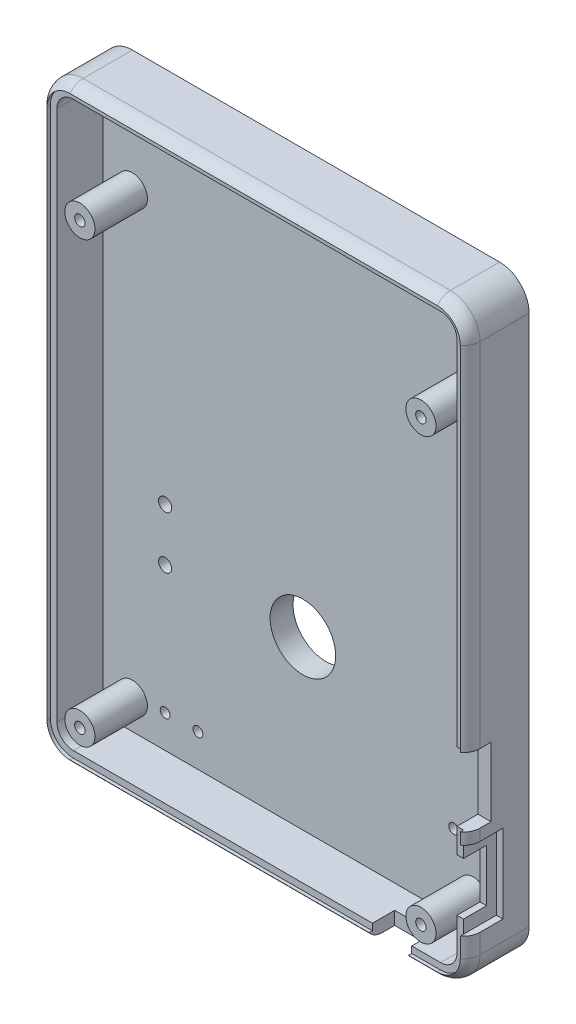
from build123d import *

# Parameters (mm, degrees)
TOP_PLATE_DEPTH                = 2
WALL_OUTER_HALF_DEPTH          = 10
WALL_INNER_HALF_DEPTH          = 9
LENS_FACE_ROUND_OVER_R         = 2.5
SKETCH_4_R                     = 8
SKETCH_4_R_2                   = 5
LENS_BEZEL_RING_DEPTH          = 1.5
SKETCH_5_R                     = 2.3
CORNER_POSTS_DEPTH             = 10
POST_START                     = 10
SKETCH_6_R                     = 0.8
POST_PILOT_HOLES_M2_DEPTH      = 7
SKETCH_7_W                     = 12
SKETCH_7_H                     = 1
GRIP_GROOVES_DEPTH             = 0.6
SKETCH_8_R                     = 1
BOOT_RESET_PINHOLES_DEPTH      = 108.993055471
SKETCH_9_W                     = 6
SKETCH_9_H                     = 4.2
SHUTTER_WINDOW_DEPTH           = 108.993055471
SKETCH_10_R                    = 5
LENS_HOLE_DEPTH                = 108.993055471
SKETCH_11_R                    = 0.75
LED_LIGHT_HOLES_D1_D4_D5_DEPTH = 108.993055471
USB_C_START                    = 59
SKETCH_12_W                    = 4.2
SKETCH_12_H                    = 10.5
USB_C_WINDOW_DEPTH             = 4.5
POWER_START                    = 59
SKETCH_13_W                    = 4.5
SKETCH_13_H                    = 8
POWER_SWITCH_SLOT_DEPTH        = 4.5
SWITCH_START                   = 61.5
SKETCH_14_W                    = 6
SKETCH_14_H                    = 12
SWITCH_FINGER_POCKET_DEPTH     = 1.5


with BuildPart() as part:
    # 草圖1 → top plate (new body)
    with BuildSketch(Plane.XY):
        with BuildLine():
            Line((2, -2.5), (58, -2.5))
            ThreePointArc((58, -2.5), (61.181980515, -1.181980515), (62.5, 2))
            Line((62.5, 2), (62.5, 83))
            ThreePointArc((62.5, 83), (61.181980515, 86.181980515), (58, 87.5))
            Line((58, 87.5), (2, 87.5))
            ThreePointArc((2, 87.5), (-1.181980515, 86.181980515), (-2.5, 83))
            Line((-2.5, 83), (-2.5, 2))
            ThreePointArc((-2.5, 2), (-1.181980515, -1.181980515), (2, -2.5))
        make_face()
    extrude(amount=TOP_PLATE_DEPTH)

    # 草圖2 → wall outer half (add)
    with BuildSketch(Plane.XY):
        with BuildLine():
            Line((2, -2.5), (58, -2.5))
            ThreePointArc((58, -2.5), (61.181980515, -1.181980515), (62.5, 2))
            Line((62.5, 2), (62.5, 83))
            ThreePointArc((62.5, 83), (61.181980515, 86.181980515), (58, 87.5))
            Line((58, 87.5), (2, 87.5))
            ThreePointArc((2, 87.5), (-1.181980515, 86.181980515), (-2.5, 83))
            Line((-2.5, 83), (-2.5, 2))
            ThreePointArc((-2.5, 2), (-1.181980515, -1.181980515), (2, -2.5))
        make_face()
        with BuildLine():
            Line((2, -1.5), (58, -1.5))
            ThreePointArc((58, -1.5), (60.474873734, -0.474873734), (61.5, 2))
            Line((61.5, 2), (61.5, 83))
            ThreePointArc((61.5, 83), (60.474873734, 85.474873734), (58, 86.5))
            Line((58, 86.5), (2, 86.5))
            ThreePointArc((2, 86.5), (-0.474873734, 85.474873734), (-1.5, 83))
            Line((-1.5, 83), (-1.5, 2))
            ThreePointArc((-1.5, 2), (-0.474873734, -0.474873734), (2, -1.5))
        make_face(mode=Mode.SUBTRACT)
    extrude(amount=WALL_OUTER_HALF_DEPTH)

    # 草圖3 → wall inner half (add)
    with BuildSketch(Plane.XY):
        with BuildLine():
            Line((2, -1.5), (58, -1.5))
            ThreePointArc((58, -1.5), (60.474873734, -0.474873734), (61.5, 2))
            Line((61.5, 2), (61.5, 83))
            ThreePointArc((61.5, 83), (60.474873734, 85.474873734), (58, 86.5))
            Line((58, 86.5), (2, 86.5))
            ThreePointArc((2, 86.5), (-0.474873734, 85.474873734), (-1.5, 83))
            Line((-1.5, 83), (-1.5, 2))
            ThreePointArc((-1.5, 2), (-0.474873734, -0.474873734), (2, -1.5))
        make_face()
        with BuildLine():
            Line((2, -0.5), (58, -0.5))
            ThreePointArc((58, -0.5), (59.767766953, 0.232233047), (60.5, 2))
            Line((60.5, 2), (60.5, 83))
            ThreePointArc((60.5, 83), (59.767766953, 84.767766953), (58, 85.5))
            Line((58, 85.5), (2, 85.5))
            ThreePointArc((2, 85.5), (0.232233047, 84.767766953), (-0.5, 83))
            Line((-0.5, 83), (-0.5, 2))
            ThreePointArc((-0.5, 2), (0.232233047, 0.232233047), (2, -0.5))
        make_face(mode=Mode.SUBTRACT)
    extrude(amount=WALL_INNER_HALF_DEPTH)

    # lens face round-over
    # the kernel refuses this fillet: 2.5 mm, written as the material it takes off along each edge
    with BuildSketch(Plane(origin=(2, 2, 10), x_dir=(-1, 0, 0), z_dir=(0, 1, 0))) as lens_face_round_over_piece_1:
        with BuildLine():
            CenterArc((4.5 - LENS_FACE_ROUND_OVER_R, -LENS_FACE_ROUND_OVER_R), LENS_FACE_ROUND_OVER_R, 0, 90)
            Line((4.5 - LENS_FACE_ROUND_OVER_R, 0), (4.5, 0))
            Line((4.5, 0), (4.5, -LENS_FACE_ROUND_OVER_R))
        make_face()
    revolve(axis=Axis((2, 2, 10), (0, 0, 1)), revolution_arc=90, mode=Mode.SUBTRACT)
    with BuildSketch(Plane(origin=(-2.5, 83, 10), x_dir=(1, 0, 0), z_dir=(0, -1, 0)), Plane(origin=(62.5, 2, 10), x_dir=(-1, 0, 0), z_dir=(0, 1, 0))) as lens_face_round_over_piece_2:
        with BuildLine():
            CenterArc((LENS_FACE_ROUND_OVER_R, -LENS_FACE_ROUND_OVER_R), LENS_FACE_ROUND_OVER_R, 90, 90)
            Line((0, -LENS_FACE_ROUND_OVER_R), (0, 0))
            Line((0, 0), (LENS_FACE_ROUND_OVER_R, 0))
        make_face()
    extrude(amount=81, mode=Mode.SUBTRACT)
    with BuildSketch(Plane(origin=(2, 83, 10), x_dir=(0, 1, 0), z_dir=(1, 0, 0))) as lens_face_round_over_piece_3:
        with BuildLine():
            CenterArc((4.5 - LENS_FACE_ROUND_OVER_R, -LENS_FACE_ROUND_OVER_R), LENS_FACE_ROUND_OVER_R, 0, 90)
            Line((4.5, -LENS_FACE_ROUND_OVER_R), (4.5, 0))
            Line((4.5, 0), (4.5 - LENS_FACE_ROUND_OVER_R, 0))
        make_face()
    revolve(axis=Axis((2, 83, 10), (0, 0, 1)), revolution_arc=90, mode=Mode.SUBTRACT)
    with BuildSketch(Plane(origin=(58, 87.5, 10), x_dir=(0, -1, 0), z_dir=(-1, 0, 0))) as lens_face_round_over_piece_4:
        with BuildLine():
            CenterArc((LENS_FACE_ROUND_OVER_R, -LENS_FACE_ROUND_OVER_R), LENS_FACE_ROUND_OVER_R, 90, 90)
            Line((0, -LENS_FACE_ROUND_OVER_R), (0, 0))
            Line((0, 0), (LENS_FACE_ROUND_OVER_R, 0))
        make_face()
    extrude(amount=56, mode=Mode.SUBTRACT)
    with BuildSketch(Plane(origin=(58, 83, 10), x_dir=(1, 0, 0), z_dir=(0, -1, 0))) as lens_face_round_over_piece_5:
        with BuildLine():
            CenterArc((4.5 - LENS_FACE_ROUND_OVER_R, -LENS_FACE_ROUND_OVER_R), LENS_FACE_ROUND_OVER_R, 0, 90)
            Line((4.5, -LENS_FACE_ROUND_OVER_R), (4.5, 0))
            Line((4.5, 0), (4.5 - LENS_FACE_ROUND_OVER_R, 0))
        make_face()
    revolve(axis=Axis((58, 83, 10), (0, 0, 1)), revolution_arc=90, mode=Mode.SUBTRACT)
    with BuildSketch(Plane(origin=(58, 2, 10), x_dir=(0, -1, 0), z_dir=(-1, 0, 0))) as lens_face_round_over_piece_6:
        with BuildLine():
            CenterArc((4.5 - LENS_FACE_ROUND_OVER_R, -LENS_FACE_ROUND_OVER_R), LENS_FACE_ROUND_OVER_R, 0, 90)
            Line((4.5, -LENS_FACE_ROUND_OVER_R), (4.5, 0))
            Line((4.5, 0), (4.5 - LENS_FACE_ROUND_OVER_R, 0))
        make_face()
    revolve(axis=Axis((58, 2, 10), (0, 0, 1)), revolution_arc=90, mode=Mode.SUBTRACT)
    with BuildSketch(Plane(origin=(2, -2.5, 10), x_dir=(0, 0, -1), z_dir=(1, 0, 0))) as lens_face_round_over_piece_7:
        with BuildLine():
            CenterArc((LENS_FACE_ROUND_OVER_R, LENS_FACE_ROUND_OVER_R), LENS_FACE_ROUND_OVER_R, 180, 90)
            Line((0, LENS_FACE_ROUND_OVER_R), (0, 0))
            Line((0, 0), (LENS_FACE_ROUND_OVER_R, 0))
        make_face()
    extrude(amount=56, mode=Mode.SUBTRACT)

    # 草圖4 → lens bezel ring (add)
    with BuildSketch(Plane.XY):
        with Locations((30, 25)):
            Circle(SKETCH_4_R)
        with Locations((30, 25)):
            Circle(SKETCH_4_R_2, mode=Mode.SUBTRACT)
    extrude(amount=-LENS_BEZEL_RING_DEPTH)

    # 草圖5 → corner posts (add)
    with BuildSketch(Plane.XY):
        with Locations((4, 4)):
            Circle(SKETCH_5_R)
        with Locations((56, 4)):
            Circle(SKETCH_5_R)
        with Locations((4, 71)):
            Circle(SKETCH_5_R)
        with Locations((56, 71)):
            Circle(SKETCH_5_R)
    extrude(amount=CORNER_POSTS_DEPTH)

    # 草圖6 → post pilot holes M2 (cut)
    with BuildSketch(Plane.XY.offset(POST_START)):
        with Locations((4, 4)):
            Circle(SKETCH_6_R)
        with Locations((56, 4)):
            Circle(SKETCH_6_R)
        with Locations((4, 71)):
            Circle(SKETCH_6_R)
        with Locations((56, 71)):
            Circle(SKETCH_6_R)
    extrude(amount=-POST_PILOT_HOLES_M2_DEPTH, mode=Mode.SUBTRACT)

    # 草圖7 → grip grooves (cut)
    with BuildSketch(Plane.XY):
        with Locations((9.5, 50)):
            Rectangle(SKETCH_7_W, SKETCH_7_H)
        with Locations((9.5, 54)):
            Rectangle(SKETCH_7_W, SKETCH_7_H)
        with Locations((9.5, 58)):
            Rectangle(SKETCH_7_W, SKETCH_7_H)
        with Locations((9.5, 62)):
            Rectangle(SKETCH_7_W, SKETCH_7_H)
        with Locations((9.5, 66)):
            Rectangle(SKETCH_7_W, SKETCH_7_H)
        with Locations((9.5, 70)):
            Rectangle(SKETCH_7_W, SKETCH_7_H)
    extrude(amount=GRIP_GROOVES_DEPTH, mode=Mode.SUBTRACT)

    # 草圖8 → BOOT/RESET pinholes (cut, through all)
    with BuildSketch(Plane.XY):
        with Locations((9, 24)):
            Circle(SKETCH_8_R)
        with Locations((9, 32)):
            Circle(SKETCH_8_R)
    extrude(amount=BOOT_RESET_PINHOLES_DEPTH, mode=Mode.SUBTRACT)

    # 草圖9 → shutter window (cut, through all)
    with BuildSketch(Plane(origin=(0, 0, 0), x_dir=(1, 0, 0), z_dir=(0, 1, 0))):
        with Locations((50.6, -7.7)):
            Rectangle(SKETCH_9_W, SKETCH_9_H)
    extrude(amount=-SHUTTER_WINDOW_DEPTH, mode=Mode.SUBTRACT)

    # 草圖10 → lens hole (cut, through all)
    with BuildSketch(Plane.XY):
        with Locations((30, 25)):
            Circle(SKETCH_10_R)
    extrude(amount=LENS_HOLE_DEPTH, mode=Mode.SUBTRACT)

    # 草圖11 → LED light holes D1 D4 D5 (cut, through all)
    with BuildSketch(Plane.XY):
        with Locations((14, 4.5)):
            Circle(SKETCH_11_R)
        with Locations((9, 4.5)):
            Circle(SKETCH_11_R)
        with Locations((53, 11.2)):
            Circle(SKETCH_11_R)
    extrude(amount=LED_LIGHT_HOLES_D1_D4_D5_DEPTH, mode=Mode.SUBTRACT)

    # 草圖12 → USB-C window (cut)
    with BuildSketch(Plane(origin=(0, 0, 0), x_dir=(0, 0, -1), z_dir=(1, 0, 0)).offset(USB_C_START)):
        with Locations((-7.9, 24)):
            Rectangle(SKETCH_12_W, SKETCH_12_H)
    extrude(amount=USB_C_WINDOW_DEPTH, mode=Mode.SUBTRACT)

    # 草圖13 → power switch slot (cut)
    with BuildSketch(Plane(origin=(0, 0, 0), x_dir=(0, 0, -1), z_dir=(1, 0, 0)).offset(POWER_START)):
        with Locations((-7.75, 11)):
            Rectangle(SKETCH_13_W, SKETCH_13_H)
    extrude(amount=POWER_SWITCH_SLOT_DEPTH, mode=Mode.SUBTRACT)

    # 草圖14 → switch finger pocket (cut)
    with BuildSketch(Plane(origin=(0, 0, 0), x_dir=(0, 0, -1), z_dir=(1, 0, 0)).offset(SWITCH_START)):
        with Locations((-7, 11)):
            Rectangle(SKETCH_14_W, SKETCH_14_H)
    extrude(amount=SWITCH_FINGER_POCKET_DEPTH, mode=Mode.SUBTRACT)


solid = part.part
